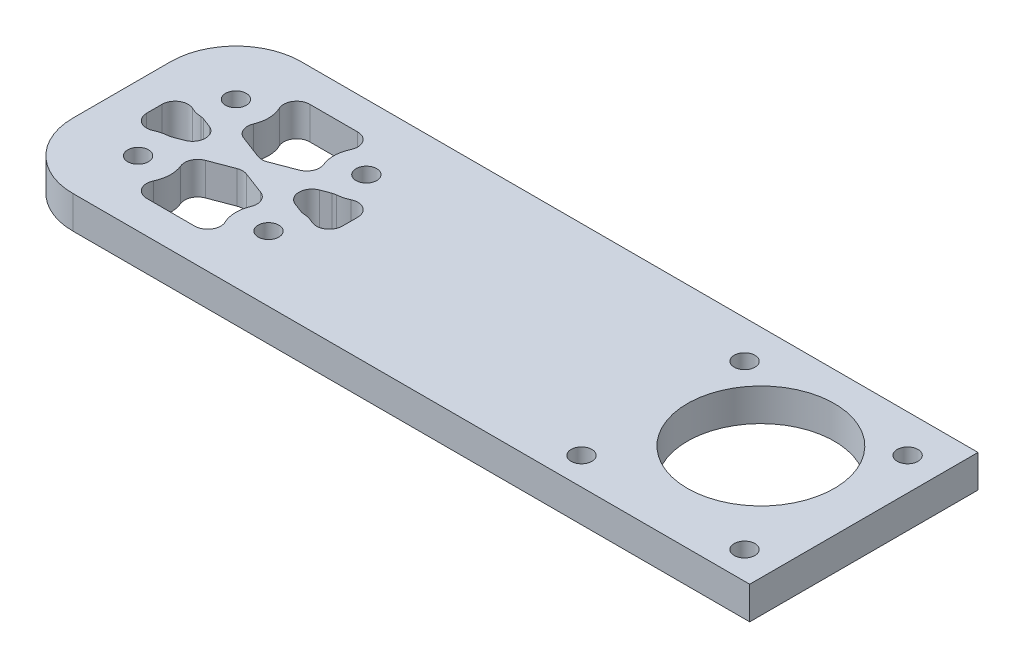
from build123d import *

# Parameters (mm, degrees)
BOSS_EXTRUDE1_DEPTH    = 6.35
F_10_32_TAPPED_HOLE2_D = 4.0386
FILLET2_R              = 12.7
CUT_EXTRUDE3_DEPTH     = 89.032651707
FILLET3_DEPTH          = 6.35
SKETCH12_R             = 14.3129
CUT_EXTRUDE4_DEPTH     = 89.032651707
SKETCH13_R             = 2.0193
CUT_EXTRUDE5_DEPTH     = 89.032651707


with BuildPart() as part:
    # Sketch1 → Boss-Extrude1 (new body)
    with BuildSketch(Plane(origin=(0, 0, 0), x_dir=(1, 0, 0), z_dir=(0, 1, 0))):
        Polygon((59.54395, 22.225), (84.94395, 22.225), (84.94395, -22.225), (59.54395, -22.225), (-59.54395, -22.225), (-59.54395, 22.225), align=None)
    extrude(amount=BOSS_EXTRUDE1_DEPTH)

    # #10-32 Tapped Hole2 (through all)
    with Locations(Plane(origin=(0, 6.35, 0), x_dir=(1, 0, 0), z_dir=(0, 1, 0))):
        with Locations((-46.84395, 9.525), (-21.44395, 9.525), (-21.44395, -9.525), (-46.84395, -9.525)):
            Hole(F_10_32_TAPPED_HOLE2_D / 2)

    # Fillet2
    fillet2_edges = [part.edges().sort_by_distance(p)[0] for p in [
        (-59.54395, 3.175, 22.225),
        (-59.54395, 3.175, -22.225),
    ]]
    fillet(fillet2_edges, radius=FILLET2_R)

    # Sketch11 → Cut-Extrude3 (cut, through all)
    with BuildSketch(Plane(origin=(0, 6.35, 0), x_dir=(1, 0, 0), z_dir=(0, 1, 0))):
        with BuildLine():
            Line((-46.84395, 15.875), (-21.44395, 15.875))
            ThreePointArc((-21.44395, 15.875), (-27.353773893, 11.848032834), (-25.767954708, 4.874679228))
            Line((-25.767954708, 4.874679228), (-34.14395, 1.697847323))
            Line((-34.14395, 1.697847323), (-42.519945292, 4.874679228))
            ThreePointArc((-42.519945292, 4.874679228), (-40.934126107, 11.848032834), (-46.84395, 15.875))
        make_face()
        with BuildLine():
            Line((-15.09395, -9.525), (-15.09395, 9.525))
            ThreePointArc((-15.09395, 9.525), (-16.90021853, 5.089123048), (-21.291431679, 3.176831905))
            Line((-21.291431679, 3.176831905), (-29.667426971, 0))
            Line((-29.667426971, 0), (-21.291431679, -3.176831905))
            ThreePointArc((-21.291431679, -3.176831905), (-16.90021853, -5.089123048), (-15.09395, -9.525))
        make_face()
        with BuildLine():
            Line((-53.19395, 9.525), (-53.19395, -9.525))
            ThreePointArc((-53.19395, -9.525), (-51.38768147, -5.089123048), (-46.996468321, -3.176831905))
            Line((-46.996468321, -3.176831905), (-38.620473029, 0))
            Line((-38.620473029, 0), (-46.996468321, 3.176831905))
            ThreePointArc((-46.996468321, 3.176831905), (-51.38768147, 5.089123048), (-53.19395, 9.525))
        make_face()
        with BuildLine():
            Line((-46.84395, -15.875), (-21.44395, -15.875))
            ThreePointArc((-21.44395, -15.875), (-27.353773893, -11.848032834), (-25.767954708, -4.874679228))
            Line((-25.767954708, -4.874679228), (-34.14395, -1.697847323))
            Line((-34.14395, -1.697847323), (-42.519945292, -4.874679228))
            ThreePointArc((-42.519945292, -4.874679228), (-40.934126107, -11.848032834), (-46.84395, -15.875))
        make_face()
    extrude(amount=-CUT_EXTRUDE3_DEPTH, mode=Mode.SUBTRACT)

    # Fillet3: read off the stored shape, not the designer's step
    # Fillet3 outline → Fillet3 (add)
    with BuildSketch(Plane(origin=(0, 0, 0), x_dir=(1, 0, 0), z_dir=(0, 1, 0))):
        with BuildLine():
            ThreePointArc((-18.722521429, 3.787724817), (-16.276262891, 3.63950655), (-15.09395, 1.492814743))
            Line((-15.09395, 1.492814743), (-15.09395, 9.525))
            ThreePointArc((-15.09395, 9.525), (-16.077220482, 6.130782227), (-18.722521429, 3.787724817))
        make_face()
        with BuildLine():
            Line((-15.09395, -9.525), (-15.09395, -1.492814743))
            ThreePointArc((-15.09395, -1.492814743), (-16.276262891, -3.63950655), (-18.722521429, -3.787724817))
            ThreePointArc((-18.722521429, -3.787724817), (-16.077220482, -6.130782227), (-15.09395, -9.525))
        make_face()
        with BuildLine():
            ThreePointArc((-21.662369003, 3.036143487), (-21.315105323, 3.140185377), (-20.956567225, 3.19373172))
            ThreePointArc((-20.956567225, 3.19373172), (-21.12388789, 3.183071252), (-21.291431679, 3.176831905))
            Line((-21.291431679, 3.176831905), (-21.662369003, 3.036143487))
        make_face()
        with BuildLine():
            ThreePointArc((-21.291431679, -3.176831905), (-21.12388789, -3.183071252), (-20.956567225, -3.19373172))
            ThreePointArc((-20.956567225, -3.19373172), (-21.315105323, -3.140185377), (-21.662369003, -3.036143487))
            Line((-21.662369003, -3.036143487), (-21.291431679, -3.176831905))
        make_face()
        with BuildLine():
            ThreePointArc((-23.405745013, -2.374919079), (-25.044990125, 0), (-23.405745013, 2.374919079))
            Line((-23.405745013, 2.374919079), (-29.667426971, 0))
            Line((-29.667426971, 0), (-23.405745013, -2.374919079))
        make_face()
        with BuildLine():
            ThreePointArc((-41.106674817, 12.246428571), (-40.95845655, 14.692687109), (-38.811764743, 15.875))
            Line((-38.811764743, 15.875), (-46.84395, 15.875))
            ThreePointArc((-46.84395, 15.875), (-43.449732228, 14.891729517), (-41.106674817, 12.246428571))
        make_face()
        with BuildLine():
            Line((-21.44395, 15.875), (-29.476135257, 15.875))
            ThreePointArc((-29.476135257, 15.875), (-27.32944345, 14.692687109), (-27.181225183, 12.246428571))
            ThreePointArc((-27.181225183, 12.246428571), (-24.838167772, 14.891729517), (-21.44395, 15.875))
        make_face()
        with BuildLine():
            ThreePointArc((-39.533862913, 3.742123461), (-40.965188005, 5.110562055), (-40.979062875, 7.090744671))
            ThreePointArc((-40.979062875, 7.090744671), (-41.630398839, 5.899895272), (-42.519945292, 4.874679228))
            Line((-42.519945292, 4.874679228), (-39.533862913, 3.742123461))
        make_face()
        with BuildLine():
            ThreePointArc((-25.767954708, 4.874679228), (-26.657501161, 5.899895272), (-27.308837125, 7.090744671))
            ThreePointArc((-27.308837125, 7.090744671), (-27.322711995, 5.110562055), (-28.754037087, 3.742123461))
            Line((-28.754037087, 3.742123461), (-25.767954708, 4.874679228))
        make_face()
        with BuildLine():
            ThreePointArc((-33.243195112, 2.03948396), (-34.14395, 1.874403039), (-35.044704888, 2.03948396))
            Line((-35.044704888, 2.03948396), (-34.14395, 1.697847323))
            Line((-34.14395, 1.697847323), (-33.243195112, 2.03948396))
        make_face()
        with BuildLine():
            Line((-38.620473029, 0), (-44.882154987, 2.374919079))
            ThreePointArc((-44.882154987, 2.374919079), (-43.242909875, 0), (-44.882154987, -2.374919079))
            Line((-44.882154987, -2.374919079), (-38.620473029, 0))
        make_face()
        with BuildLine():
            ThreePointArc((-47.331332775, 3.19373172), (-46.972794677, 3.140185377), (-46.625530997, 3.036143487))
            Line((-46.625530997, 3.036143487), (-46.996468321, 3.176831905))
            ThreePointArc((-46.996468321, 3.176831905), (-47.16401211, 3.183071252), (-47.331332775, 3.19373172))
        make_face()
        with BuildLine():
            Line((-46.996468321, -3.176831905), (-46.625530997, -3.036143487))
            ThreePointArc((-46.625530997, -3.036143487), (-46.972794677, -3.140185377), (-47.331332775, -3.19373172))
            ThreePointArc((-47.331332775, -3.19373172), (-47.16401211, -3.183071252), (-46.996468321, -3.176831905))
        make_face()
        with BuildLine():
            ThreePointArc((-53.19395, 1.492814743), (-52.011637109, 3.63950655), (-49.565378571, 3.787724817))
            ThreePointArc((-49.565378571, 3.787724817), (-52.210679518, 6.130782227), (-53.19395, 9.525))
            Line((-53.19395, 9.525), (-53.19395, 1.492814743))
        make_face()
        with BuildLine():
            ThreePointArc((-53.19395, -9.525), (-52.210679518, -6.130782227), (-49.565378571, -3.787724816))
            ThreePointArc((-49.565378571, -3.787724816), (-52.011637109, -3.63950655), (-53.19395, -1.492814743))
            Line((-53.19395, -1.492814743), (-53.19395, -9.525))
        make_face()
        with BuildLine():
            ThreePointArc((-40.979062875, -7.090744671), (-40.965188005, -5.110562055), (-39.533862913, -3.742123461))
            Line((-39.533862913, -3.742123461), (-42.519945292, -4.874679228))
            ThreePointArc((-42.519945292, -4.874679228), (-41.630398839, -5.899895272), (-40.979062875, -7.090744671))
        make_face()
        with BuildLine():
            Line((-34.14395, -1.697847323), (-35.044704888, -2.03948396))
            ThreePointArc((-35.044704888, -2.03948396), (-34.14395, -1.874403039), (-33.243195112, -2.03948396))
            Line((-33.243195112, -2.03948396), (-34.14395, -1.697847323))
        make_face()
        with BuildLine():
            ThreePointArc((-38.811764743, -15.875), (-40.95845655, -14.692687109), (-41.106674817, -12.246428571))
            ThreePointArc((-41.106674817, -12.246428571), (-43.449732228, -14.891729517), (-46.84395, -15.875))
            Line((-46.84395, -15.875), (-38.811764743, -15.875))
        make_face()
        with BuildLine():
            Line((-25.767954708, -4.874679228), (-28.754037087, -3.742123461))
            ThreePointArc((-28.754037087, -3.742123461), (-27.322711995, -5.110562055), (-27.308837125, -7.090744671))
            ThreePointArc((-27.308837125, -7.090744671), (-26.657501161, -5.899895272), (-25.767954708, -4.874679228))
        make_face()
        with BuildLine():
            ThreePointArc((-27.181225183, -12.246428571), (-27.32944345, -14.692687109), (-29.476135257, -15.875))
            Line((-29.476135257, -15.875), (-21.44395, -15.875))
            ThreePointArc((-21.44395, -15.875), (-24.838167772, -14.891729517), (-27.181225183, -12.246428571))
        make_face()
    extrude(amount=FILLET3_DEPTH)

    # Sketch12 → Cut-Extrude4 (cut, through all)
    with BuildSketch(Plane(origin=(0, 6.35, 0), x_dir=(1, 0, 0), z_dir=(0, 1, 0))):
        with Locations(Location((62.71895, 2.175, 0), (0, 0, 270))):
            Circle(SKETCH12_R)
    extrude(amount=-CUT_EXTRUDE4_DEPTH, mode=Mode.SUBTRACT)

    # Sketch13 → Cut-Extrude5 (cut, through all)
    with BuildSketch(Plane(origin=(0, 6.35, 0), x_dir=(1, 0, 0), z_dir=(0, 1, 0))):
        with Locations(Location((78.59395, 14.875, 0), (0, 0, 270))):
            Circle(SKETCH13_R)
        with Locations(Location((46.84395, 14.875, 0), (0, 0, 270))):
            Circle(SKETCH13_R)
        with Locations(Location((46.84395, -16.875, 0), (0, 0, 270))):
            Circle(SKETCH13_R)
        with Locations(Location((78.59395, -16.875, 0), (0, 0, 270))):
            Circle(SKETCH13_R)
    extrude(amount=-CUT_EXTRUDE5_DEPTH, mode=Mode.SUBTRACT)


solid = part.part
